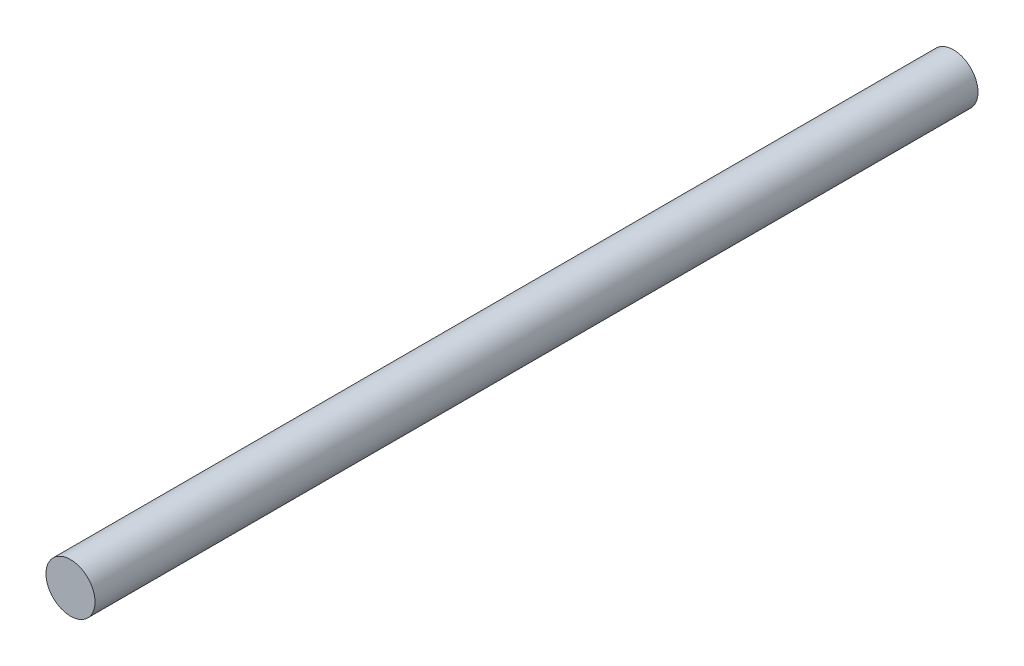
from build123d import *

# Parameters (mm, degrees)
BOSS_EXTRUDE1_START     = -114.3
BOSS_EXTRUDE1_OUTLINE_R = 3.175
BOSS_EXTRUDE1_DEPTH     = 114.3


# Read off the part's stored shape, not the designer's step: Boss-Extrude1
with BuildPart() as part:
    # Boss-Extrude1 outline → Boss-Extrude1 (new body)
    with BuildSketch(Plane.XY.offset(98.3791731).offset(BOSS_EXTRUDE1_START)):
        Circle(BOSS_EXTRUDE1_OUTLINE_R)
    extrude(amount=BOSS_EXTRUDE1_DEPTH)


solid = part.part
